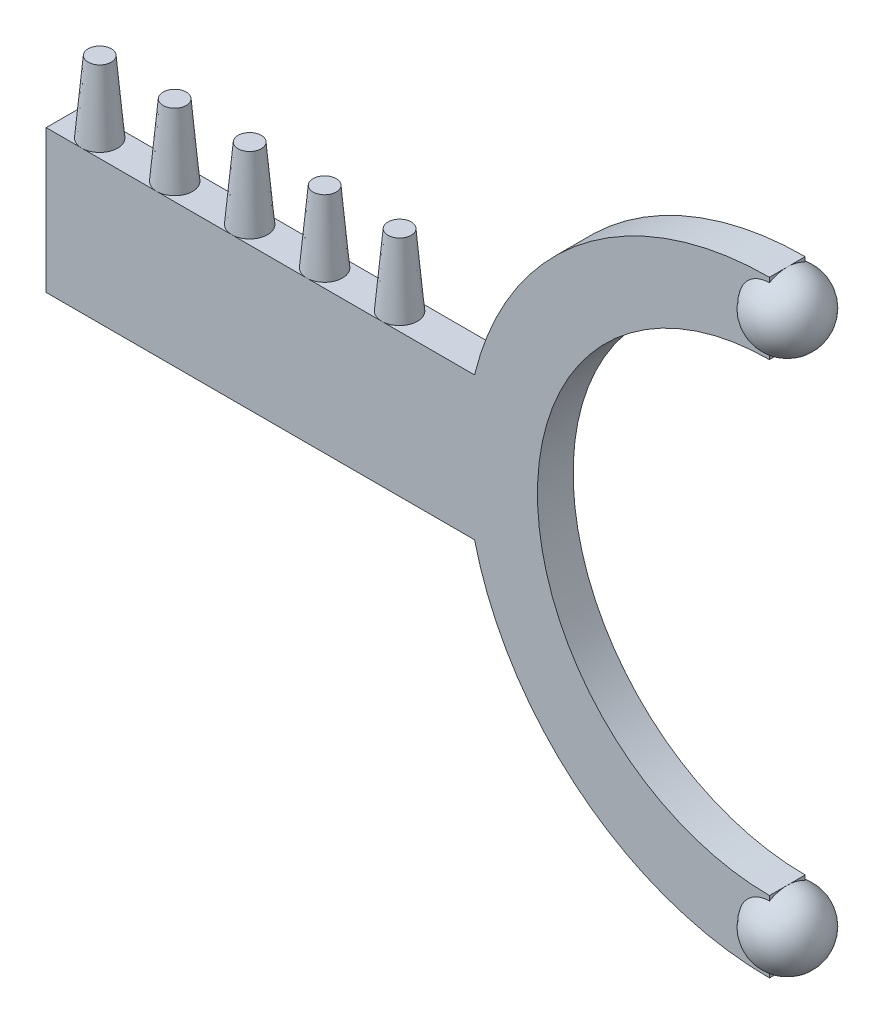
from build123d import *

# Parameters (mm, degrees)
BOSS_EXTRUDE1_DEPTH           = 0.5
SKETCH2_R                     = 0.5
BOSS_EXTRUDE2_DEPTH           = 2
BOSS_EXTRUDE2_DRAFT           = 5
BOSS_EXTRUDE2_PROFILE_2_DEPTH = 2
BOSS_EXTRUDE2_PROFILE_2_DRAFT = 5
BOSS_EXTRUDE2_PROFILE_3_DEPTH = 2
BOSS_EXTRUDE2_PROFILE_3_DRAFT = 5
BOSS_EXTRUDE2_PROFILE_4_DEPTH = 2
BOSS_EXTRUDE2_PROFILE_4_DRAFT = 5
BOSS_EXTRUDE2_PROFILE_5_DEPTH = 2
BOSS_EXTRUDE2_PROFILE_5_DRAFT = 5


with BuildPart() as part:
    # Sketch1 → Boss-Extrude1 (new, symmetric)
    with BuildSketch(Plane.XY):
        with BuildLine():
            Line((-8.261355821, 2), (-20.261355821, 2))
            Line((-20.261355821, 2), (-20.261355821, -2))
            Line((-20.261355821, -2), (-8.261355821, -2))
            ThreePointArc((-8.261355821, -2), (-5.25594901, -6.680194608), (0, -8.5))
            Line((0, -8.5), (0, -6.5))
            ThreePointArc((0, -6.5), (-6.5, 0), (0, 6.5))
            Line((0, 6.5), (0, 8.5))
            ThreePointArc((0, 8.5), (-5.25594901, 6.680194608), (-8.261355821, 2))
        make_face()
    extrude(amount=BOSS_EXTRUDE1_DEPTH, both=True)

    # Sketch1<7> → Revolve14 (revolve)
    with BuildSketch(Plane.XY):
        with BuildLine():
            Line((0, 6.5), (0, 8.5))
            ThreePointArc((0, 8.5), (-1, 7.5), (0, 6.5))
        make_face()
        with BuildLine():
            ThreePointArc((0, -6.5), (-1, -7.5), (0, -8.5))
            Line((0, -8.5), (0, -6.5))
        make_face()
    revolve(axis=Axis((0, 0, 0), (0, 1, 0)))


with BuildPart() as boss_extrude2_tool:
    # Sketch2 → Boss-Extrude2 (with draft: the straight prism first)
    with BuildSketch(Plane(origin=(0, 2, 0), x_dir=(1, 0, 0), z_dir=(0, 1, 0))):
        with Locations((-19.261355821, 0)):
            Circle(SKETCH2_R)
    extrude(amount=BOSS_EXTRUDE2_DEPTH)
    # Boss-Extrude2: the draft: its side faces are tilted about the plane it starts from
    boss_extrude2_sides = [boss_extrude2_tool.faces().sort_by_distance(p)[0] for p in [
        (-19.761355821, 3, 0),
    ]]
    draft(boss_extrude2_sides, Plane(origin=(0, 2, 0), x_dir=(1, 0, 0), z_dir=(0, 1, 0)), BOSS_EXTRUDE2_DRAFT)


with BuildPart() as part_1:
    add(part.part)

    # Boss-Extrude2: add boss_extrude2_tool
    add(boss_extrude2_tool.part)


with BuildPart() as boss_extrude2_profile_2_tool:
    # Sketch2 → Boss-Extrude2 profile 2 (with draft: the straight prism first)
    with BuildSketch(Plane(origin=(0, 2, 0), x_dir=(1, 0, 0), z_dir=(0, 1, 0))):
        with Locations((-17.161355821, 0)):
            Circle(SKETCH2_R)
    extrude(amount=BOSS_EXTRUDE2_PROFILE_2_DEPTH)
    # Boss-Extrude2 profile 2: the draft: its side faces are tilted about the plane it starts from
    boss_extrude2_profile_2_sides = [boss_extrude2_profile_2_tool.faces().sort_by_distance(p)[0] for p in [
        (-17.661355821, 3, 0),
    ]]
    draft(boss_extrude2_profile_2_sides, Plane(origin=(0, 2, 0), x_dir=(1, 0, 0), z_dir=(0, 1, 0)), BOSS_EXTRUDE2_PROFILE_2_DRAFT)


with BuildPart() as part_2:
    add(part_1.part)

    # Boss-Extrude2 profile 2: add boss_extrude2_profile_2_tool
    add(boss_extrude2_profile_2_tool.part)


with BuildPart() as boss_extrude2_profile_3_tool:
    # Sketch2 → Boss-Extrude2 profile 3 (with draft: the straight prism first)
    with BuildSketch(Plane(origin=(0, 2, 0), x_dir=(1, 0, 0), z_dir=(0, 1, 0))):
        with Locations((-15.061355821, 0)):
            Circle(SKETCH2_R)
    extrude(amount=BOSS_EXTRUDE2_PROFILE_3_DEPTH)
    # Boss-Extrude2 profile 3: the draft: its side faces are tilted about the plane it starts from
    boss_extrude2_profile_3_sides = [boss_extrude2_profile_3_tool.faces().sort_by_distance(p)[0] for p in [
        (-15.561355821, 3, 0),
    ]]
    draft(boss_extrude2_profile_3_sides, Plane(origin=(0, 2, 0), x_dir=(1, 0, 0), z_dir=(0, 1, 0)), BOSS_EXTRUDE2_PROFILE_3_DRAFT)


with BuildPart() as part_3:
    add(part_2.part)

    # Boss-Extrude2 profile 3: add boss_extrude2_profile_3_tool
    add(boss_extrude2_profile_3_tool.part)


with BuildPart() as boss_extrude2_profile_4_tool:
    # Sketch2 → Boss-Extrude2 profile 4 (with draft: the straight prism first)
    with BuildSketch(Plane(origin=(0, 2, 0), x_dir=(1, 0, 0), z_dir=(0, 1, 0))):
        with Locations((-12.961355821, 0)):
            Circle(SKETCH2_R)
    extrude(amount=BOSS_EXTRUDE2_PROFILE_4_DEPTH)
    # Boss-Extrude2 profile 4: the draft: its side faces are tilted about the plane it starts from
    boss_extrude2_profile_4_sides = [boss_extrude2_profile_4_tool.faces().sort_by_distance(p)[0] for p in [
        (-13.461355821, 3, 0),
    ]]
    draft(boss_extrude2_profile_4_sides, Plane(origin=(0, 2, 0), x_dir=(1, 0, 0), z_dir=(0, 1, 0)), BOSS_EXTRUDE2_PROFILE_4_DRAFT)


with BuildPart() as part_4:
    add(part_3.part)

    # Boss-Extrude2 profile 4: add boss_extrude2_profile_4_tool
    add(boss_extrude2_profile_4_tool.part)


with BuildPart() as boss_extrude2_profile_5_tool:
    # Sketch2 → Boss-Extrude2 profile 5 (with draft: the straight prism first)
    with BuildSketch(Plane(origin=(0, 2, 0), x_dir=(1, 0, 0), z_dir=(0, 1, 0))):
        with Locations((-10.861355821, 0)):
            Circle(SKETCH2_R)
    extrude(amount=BOSS_EXTRUDE2_PROFILE_5_DEPTH)
    # Boss-Extrude2 profile 5: the draft: its side faces are tilted about the plane it starts from
    boss_extrude2_profile_5_sides = [boss_extrude2_profile_5_tool.faces().sort_by_distance(p)[0] for p in [
        (-11.361355821, 3, 0),
    ]]
    draft(boss_extrude2_profile_5_sides, Plane(origin=(0, 2, 0), x_dir=(1, 0, 0), z_dir=(0, 1, 0)), BOSS_EXTRUDE2_PROFILE_5_DRAFT)


with BuildPart() as part_5:
    add(part_4.part)

    # Boss-Extrude2 profile 5: add boss_extrude2_profile_5_tool
    add(boss_extrude2_profile_5_tool.part)


solid = part_5.part
